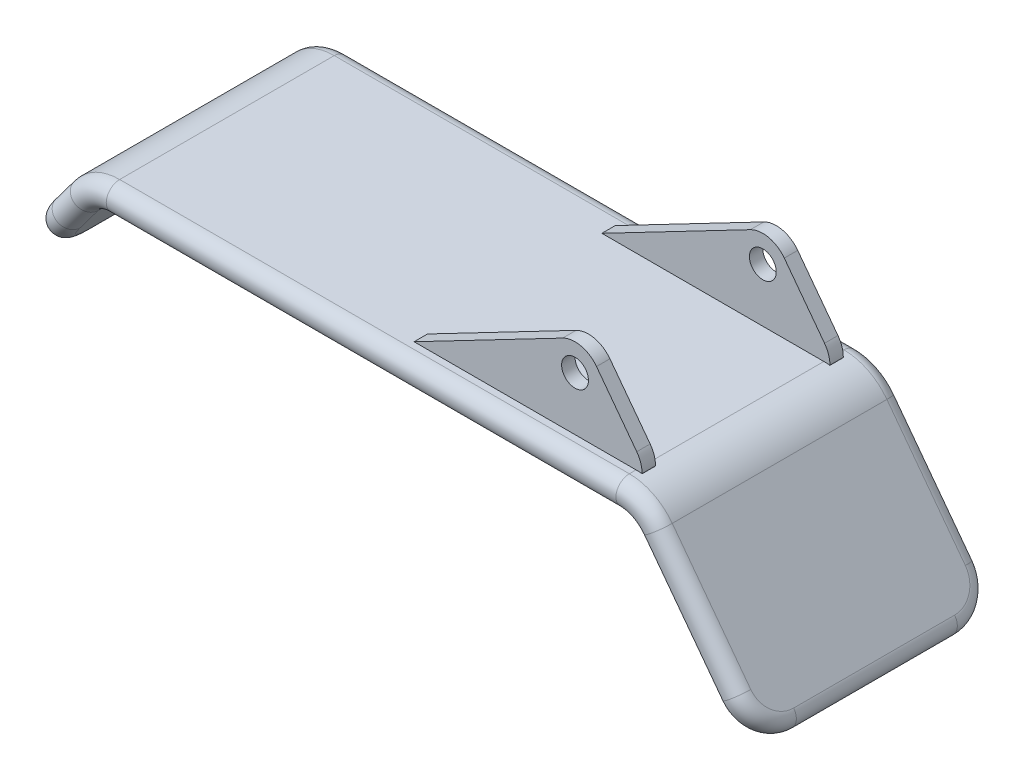
from build123d import *

# Parameters (mm, degrees)
EXTRUDE_THIN1_DEPTH = 9
FILLET1_R           = 3
FILLET2_R           = 1
SKETCH2_R           = 1
EXTRUDE1_DEPTH      = 1


with BuildPart() as part:
    # Sketch1 → Extrude-Thin1 (new, symmetric)
    with BuildSketch(Plane.XY):
        with BuildLine():
            Line((-23.75, -5), (-20.6, -0.8))
            ThreePointArc((-20.6, -0.8), (-19.894427191, -0.211145618), (-19, 0))
            Line((-19, 0), (19, 0))
            ThreePointArc((19, 0), (19.894427191, -0.211145618), (20.6, -0.8))
            Line((20.6, -0.8), (28.25, -11))
            Line((28.25, -11), (29.85, -9.8))
            Line((29.85, -9.8), (22.2, 0.4))
            ThreePointArc((22.2, 0.4), (20.788854382, 1.577708764), (19, 2))
            Line((19, 2), (-19, 2))
            ThreePointArc((-19, 2), (-20.788854382, 1.577708764), (-22.2, 0.4))
            Line((-22.2, 0.4), (-25.35, -3.8))
            Line((-25.35, -3.8), (-23.75, -5))
        make_face()
    extrude(amount=EXTRUDE_THIN1_DEPTH, both=True)

    # Fillet1
    fillet1_edges = [part.edges().sort_by_distance(p)[0] for p in [
        (29.05, -10.4, -9),
        (-24.55, -4.4, -9),
        (29.05, -10.4, 9),
        (-24.55, -4.4, 9),
    ]]
    fillet(fillet1_edges, radius=FILLET1_R)

    # Fillet2
    fillet2_edges = [part.edges().sort_by_distance(p)[0] for p in [
        (-21.275, -1.7, 9),
        (20.788854382, 1.577708764, -9),
        (0, 0, -9),
        (-20.788854382, 1.577708764, -9),
        (-21.275, -1.7, -9),
        (-22.875, -0.5, -9),
        (-20.788854382, 1.577708764, 9),
        (0, 0, 9),
        (20.788854382, 1.577708764, 9),
        (-23.75, -5, 0),
        (-25.35, -3.8, 0),
        (-24.822792206, -3.097056275, -8.121320344),
        (0, 2, 9),
        (-24.822792206, -3.097056275, 8.121320344),
        (23.525, -4.7, 9),
        (25.125, -3.5, 9),
        (25.125, -3.5, -9),
        (23.525, -4.7, -9),
        (28.25, -11, 0),
        (29.322792206, -9.097056275, 8.121320344),
        (-22.875, -0.5, 9),
        (27.722792206, -10.297056275, -8.121320344),
        (29.85, -9.8, 0),
        (0, 2, -9),
    ]]
    fillet(fillet2_edges, radius=FILLET2_R - 0.0001)  # a hair under: the kernel refuses the full size

    # Sketch2 → Extrude1 (add)
    with BuildSketch(Plane.XY.offset(7.5)):
        with BuildLine():
            Line((2.45, 2), (13.5255002, 7.7734994))
            ThreePointArc((13.5255002, 7.7734994), (14.893058146, 7.950307535), (16.05, 7.2))
            Line((16.05, 7.2), (19.05, 3.2))
            ThreePointArc((19.05, 3.2), (19.347366596, 2.632455532), (19.45, 2))
            Line((19.45, 2), (19.45, 1.974606899))
            ThreePointArc((19.45, 1.974606899), (19.225357943, 1.993646679), (19, 2))
            Line((19, 2), (2.45, 2))
        make_face()
        with Locations((14.45, 6)):
            Circle(SKETCH2_R, mode=Mode.SUBTRACT)
    extrude1 = extrude(amount=-EXTRUDE1_DEPTH)

    # Mirror1: Extrude1 across plane
    add(extrude1.mirror(Plane.XY))


solid = part.part
